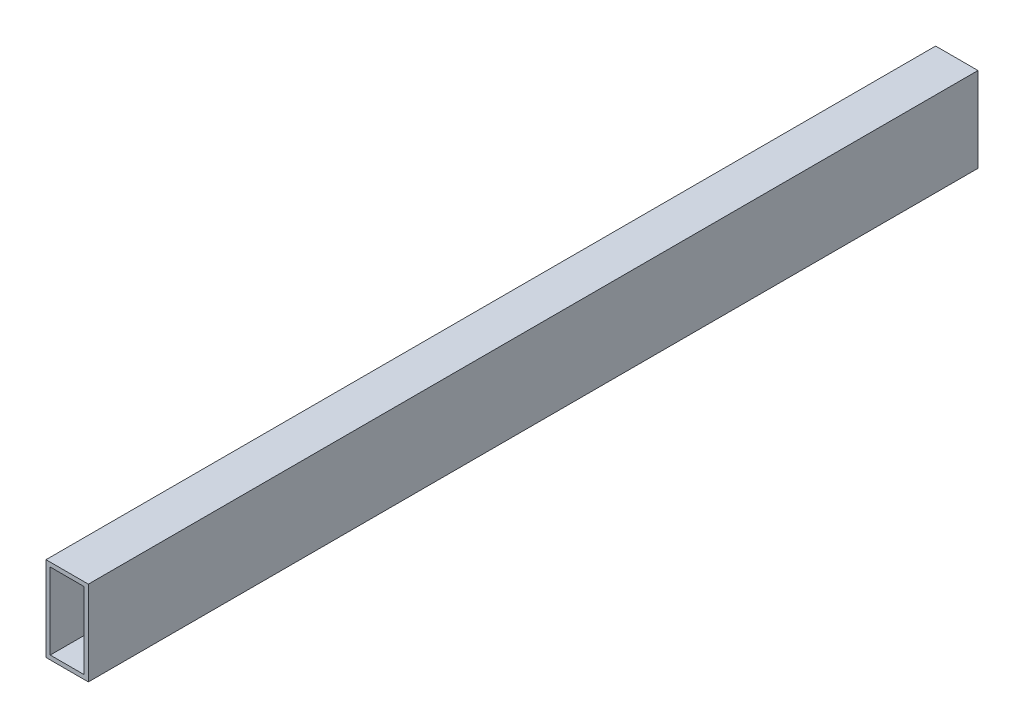
from build123d import *

# Parameters (mm, degrees)
SKETCH1_W           = 25.4
SKETCH1_H           = 50.8
SKETCH1_W_2         = 20.32
SKETCH1_H_2         = 45.72
EXTRUDE_THIN1_DEPTH = 533.4


with BuildPart() as part:
    # Sketch1 → Extrude-Thin1 (new body)
    with BuildSketch(Plane.XY):
        Rectangle(SKETCH1_W, SKETCH1_H)
        Rectangle(SKETCH1_W_2, SKETCH1_H_2, mode=Mode.SUBTRACT)
    extrude(amount=EXTRUDE_THIN1_DEPTH)


solid = part.part
